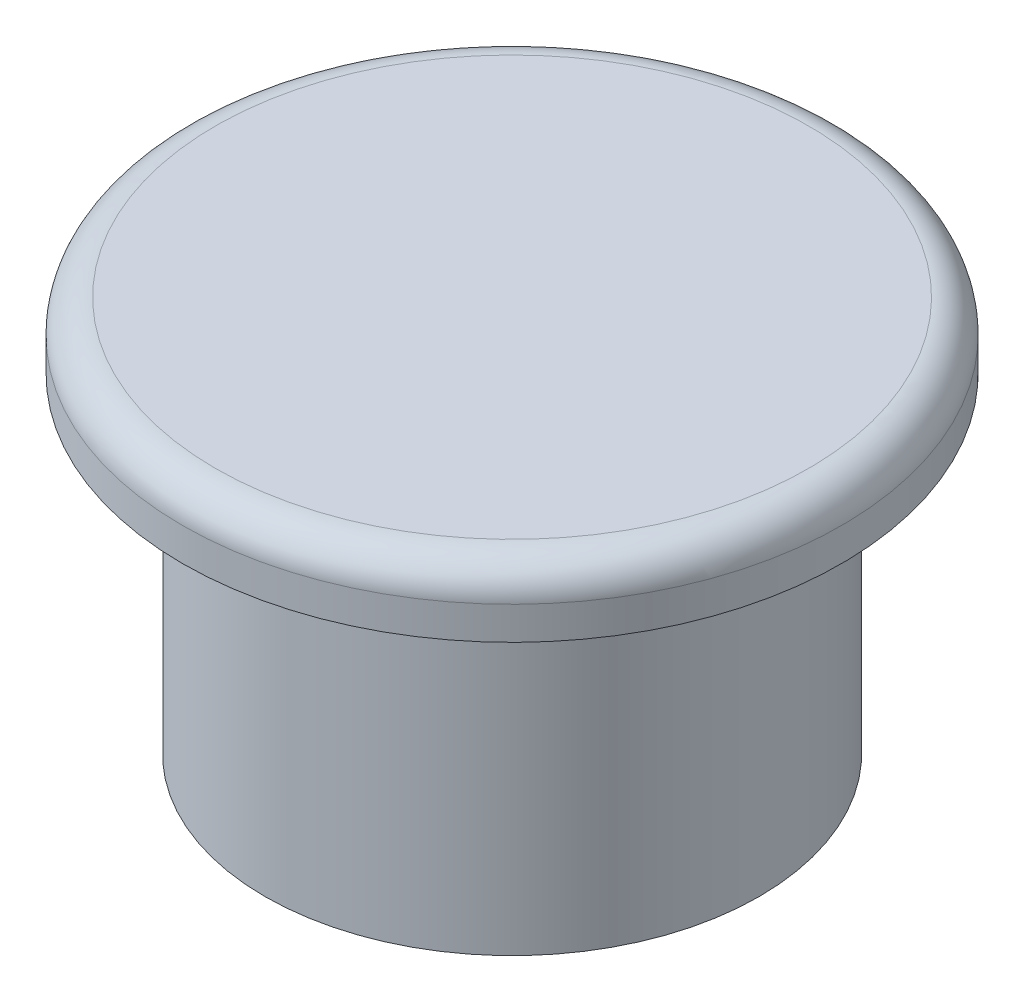
from build123d import *

# Parameters (mm, degrees)
SKETCH1_R           = 0.75
SKETCH1_R_2         = 0.625
BOSS_EXTRUDE1_DEPTH = 1
SKETCH2_R           = 1
BOSS_EXTRUDE2_DEPTH = 0.2
FILLET1_R           = 0.1


with BuildPart() as part:
    # Sketch1 → Boss-Extrude1 (new body)
    with BuildSketch(Plane(origin=(0, 0, 0), x_dir=(1, 0, 0), z_dir=(0, 1, 0))):
        Circle(SKETCH1_R)
        Circle(SKETCH1_R_2, mode=Mode.SUBTRACT)
    extrude(amount=BOSS_EXTRUDE1_DEPTH)

    # Sketch2 → Boss-Extrude2 (add)
    with BuildSketch(Plane(origin=(0, 1, 0), x_dir=(1, 0, 0), z_dir=(0, 1, 0))):
        Circle(SKETCH2_R)
    extrude(amount=BOSS_EXTRUDE2_DEPTH)

    # Fillet1
    fillet1_edges = [part.edges().sort_by_distance(p)[0] for p in [
        (-1, 1.2, 0),
    ]]
    fillet(fillet1_edges, radius=FILLET1_R)


solid = part.part
